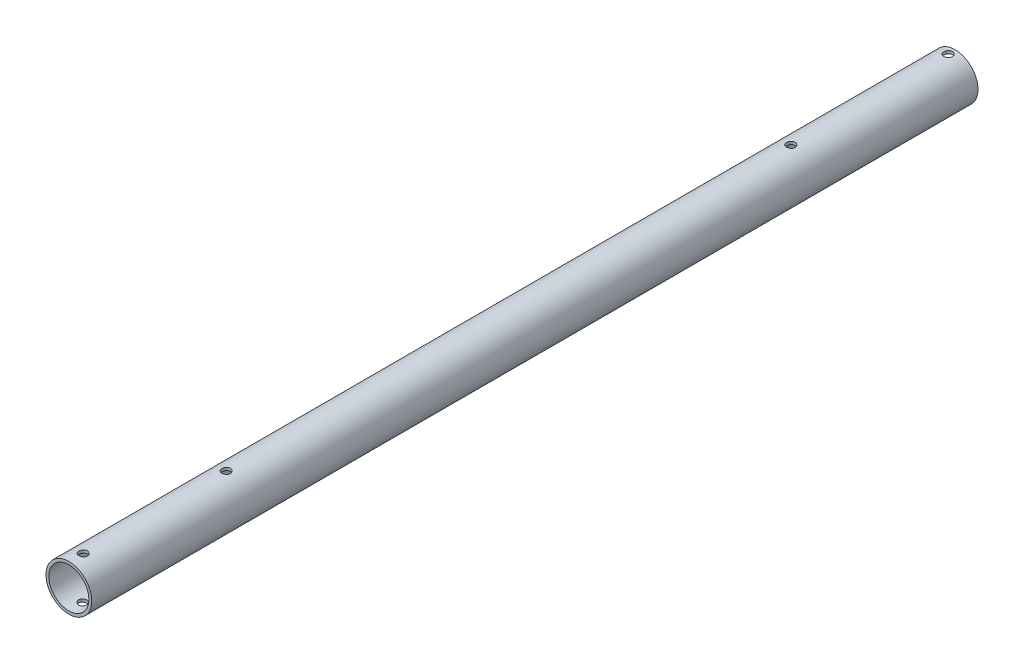
from build123d import *

# Parameters (mm, degrees)
SKETCH1_R           = 8
SKETCH1_R_2         = 7
BOSS_EXTRUDE1_DEPTH = 310
SKETCH2_R           = 1.5
CUT_EXTRUDE2_DEPTH  = 20


with BuildPart() as part:
    # Sketch1 → Boss-Extrude1 (new body)
    with BuildSketch(Plane.XY):
        Circle(SKETCH1_R)
        Circle(SKETCH1_R_2, mode=Mode.SUBTRACT)
    extrude(amount=BOSS_EXTRUDE1_DEPTH)

    # Sketch2 → Cut-Extrude2 (cut)
    with BuildSketch(Plane.XZ.offset(10)):
        with Locations((0, 57.5)):
            Circle(SKETCH2_R)
        with Locations((0, 305)):
            Circle(SKETCH2_R)
        with Locations((0, 255)):
            Circle(SKETCH2_R)
        with Locations((0, 2.5)):
            Circle(SKETCH2_R)
    extrude(amount=-CUT_EXTRUDE2_DEPTH, mode=Mode.SUBTRACT)


solid = part.part
